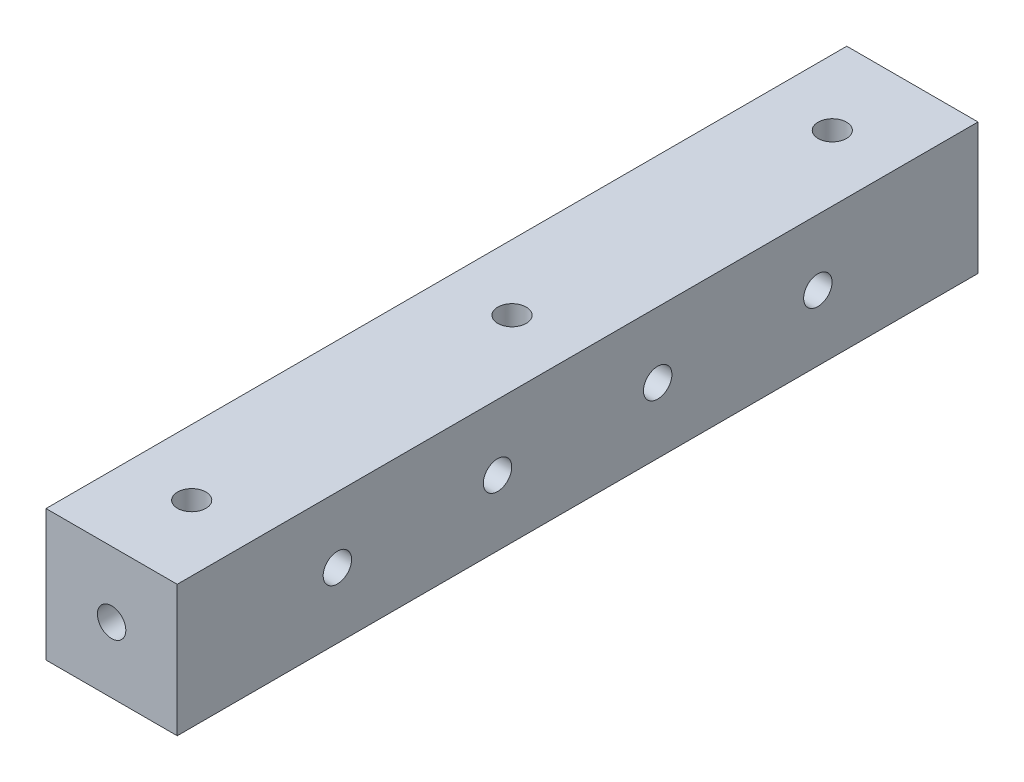
from build123d import *

# Parameters (mm, degrees)
SKETCH1_W                = 25.4
SKETCH1_H                = 25.4
BOSS_EXTRUDE1_DEPTH      = 77.5
M5_CLEARANCE_HOLE1_D     = 5.5
M5_CLEARANCE_HOLE2_D     = 5.5
M5_CLEARANCE_HOLE3_D     = 5.5
M5_CLEARANCE_HOLE3_DEPTH = 10
M5_CLEARANCE_HOLE3_TIP   = 1.652366702


with BuildPart() as part:
    # Sketch1 → Boss-Extrude1 (new, symmetric)
    with BuildSketch(Plane.XY):
        Rectangle(SKETCH1_W, SKETCH1_H)
    extrude(amount=BOSS_EXTRUDE1_DEPTH, both=True)

    # M5 Clearance Hole1 (through all)
    with Locations(Plane(origin=(12.7, 0, 0), x_dir=(0, 0, -1), z_dir=(1, 0, 0))):
        with Locations((-46.5, 0), (-15.5, 0), (15.5, 0), (46.5, 0)):
            Hole(M5_CLEARANCE_HOLE1_D / 2)

    # M5 Clearance Hole2 (through all)
    with Locations(Plane(origin=(0, -12.7, 0), x_dir=(-1, 0, 0), z_dir=(0, -1, 0))):
        with Locations((0, -62), (0, 0), (0, 62)):
            Hole(M5_CLEARANCE_HOLE2_D / 2)

    # M5 Clearance Hole3
    with Locations(Plane.XY.offset(77.5)):
        with Locations((0, 0)):
            Hole(M5_CLEARANCE_HOLE3_D / 2, depth=M5_CLEARANCE_HOLE3_DEPTH)
            with Locations((0, 0, -(M5_CLEARANCE_HOLE3_DEPTH + M5_CLEARANCE_HOLE3_TIP / 2))):  # 118° drill point
                Cone(0, M5_CLEARANCE_HOLE3_D / 2, M5_CLEARANCE_HOLE3_TIP, mode=Mode.SUBTRACT)


solid = part.part
